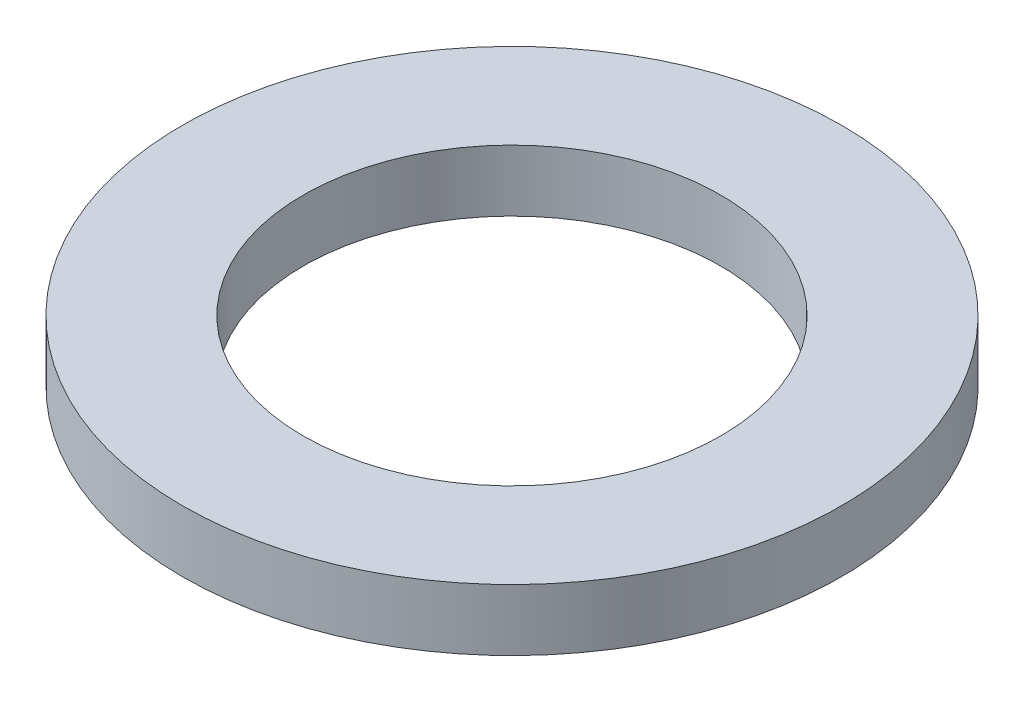
from build123d import *

# Parameters (mm, degrees)
SKETCH1_R           = 75
BOSS_EXTRUDE1_DEPTH = 14
SKETCH2_R           = 47.5
CUT_EXTRUDE1_DEPTH  = 107.98598039


with BuildPart() as part:
    # Sketch1 → Boss-Extrude1 (new body)
    with BuildSketch(Plane(origin=(0, 0, 0), x_dir=(1, 0, 0), z_dir=(0, 1, 0))):
        Circle(SKETCH1_R)
    extrude(amount=BOSS_EXTRUDE1_DEPTH)

    # Sketch2 → Cut-Extrude1 (cut, through all)
    with BuildSketch(Plane(origin=(0, 0, 0), x_dir=(1, 0, 0), z_dir=(0, 1, 0))):
        Circle(SKETCH2_R)
    extrude(amount=CUT_EXTRUDE1_DEPTH, mode=Mode.SUBTRACT)


solid = part.part
